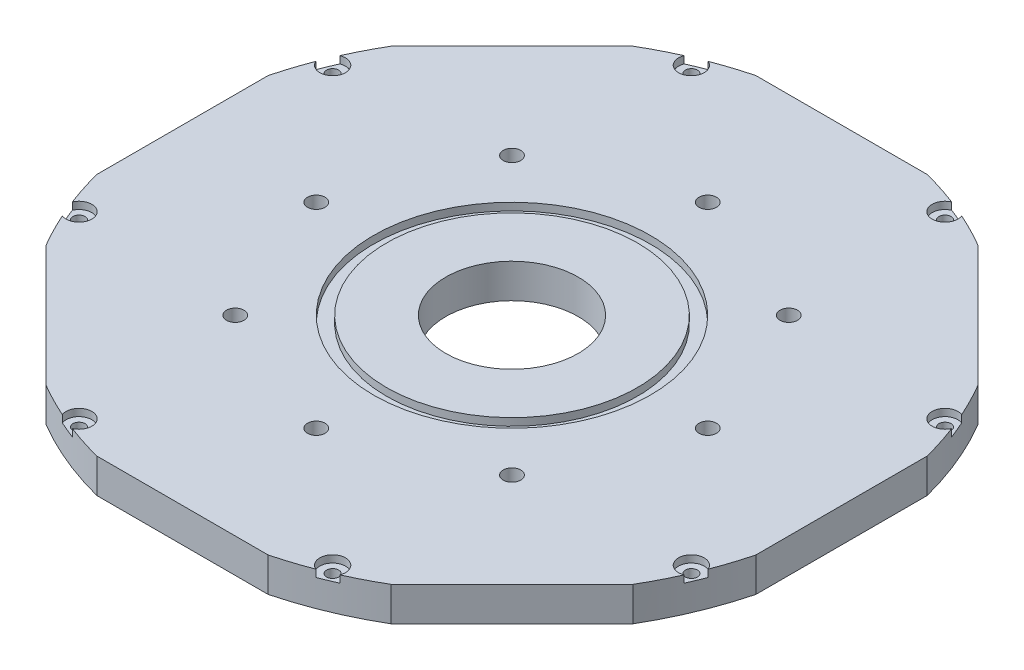
from build123d import *

# Parameters (mm, degrees)
BOSS_EXTRUDE1_DEPTH                                 = 12.7
SKETCH3_R                                           = 24.5745
CUT_EXTRUDE1_DEPTH                                  = 174.423960282
SKETCH5_R                                           = 51.3715
SKETCH5_R_2                                         = 46.5455
CUT_EXTRUDE2_DEPTH                                  = 2.794
CIRPATTERN4_COUNT                                   = 8
CBORE_FOR_8_BINDING_HEAD_MACHINE_SCREW2_D           = 4.4958
CBORE_FOR_8_BINDING_HEAD_MACHINE_SCREW2_CBORE_D     = 9.525
CBORE_FOR_8_BINDING_HEAD_MACHINE_SCREW2_CBORE_DEPTH = 2.667
CIRPATTERN5_COUNT                                   = 8


with BuildPart() as part:
    # Sketch1 → Boss-Extrude1 (new body)
    with BuildSketch(Plane(origin=(0, 0, 0), x_dir=(1, 0, 0), z_dir=(0, 1, 0))):
        with BuildLine():
            ThreePointArc((-31.793446259, 122.3), (-48.357791931, 116.746037126), (-63.997797892, 108.960520786))
            Line((-63.997797892, 108.960520786), (-108.960520786, 63.997797892))
            ThreePointArc((-108.960520786, 63.997797892), (-116.746037126, 48.357791931), (-122.3, 31.793446259))
            Line((-122.3, 31.793446259), (-122.3, -31.793446259))
            ThreePointArc((-122.3, -31.793446259), (-116.746037126, -48.357791931), (-108.960520786, -63.997797892))
            Line((-108.960520786, -63.997797892), (-63.997797892, -108.960520786))
            ThreePointArc((-63.997797892, -108.960520786), (-48.357791931, -116.746037126), (-31.793446259, -122.3))
            Line((-31.793446259, -122.3), (31.793446259, -122.3))
            ThreePointArc((31.793446259, -122.3), (48.357791931, -116.746037126), (63.997797892, -108.960520786))
            Line((63.997797892, -108.960520786), (108.960520786, -63.997797892))
            ThreePointArc((108.960520786, -63.997797892), (116.746037126, -48.357791931), (122.3, -31.793446259))
            Line((122.3, -31.793446259), (122.3, 31.793446259))
            ThreePointArc((122.3, 31.793446259), (116.746037126, 48.357791931), (108.960520786, 63.997797892))
            Line((108.960520786, 63.997797892), (63.997797892, 108.960520786))
            ThreePointArc((63.997797892, 108.960520786), (48.357791931, 116.746037126), (31.793446259, 122.3))
            Line((31.793446259, 122.3), (-31.793446259, 122.3))
        make_face()
    extrude(amount=BOSS_EXTRUDE1_DEPTH)

    # Sketch3 → Cut-Extrude1 (cut, through all)
    with BuildSketch(Plane(origin=(0, 12.7, 0), x_dir=(1, 0, 0), z_dir=(0, 1, 0))):
        Circle(SKETCH3_R)
    extrude(amount=-CUT_EXTRUDE1_DEPTH, mode=Mode.SUBTRACT)

    # Sketch5 → Cut-Extrude2 (cut)
    with BuildSketch(Plane(origin=(0, 12.7, 0), x_dir=(1, 0, 0), z_dir=(0, 1, 0))):
        Circle(SKETCH5_R)
        Circle(SKETCH5_R_2, mode=Mode.SUBTRACT)
    extrude(amount=-CUT_EXTRUDE2_DEPTH, mode=Mode.SUBTRACT)

    # Sketch23 → 5/16-18 Tapped Hole1 (revolve, cut)
    with BuildSketch(Plane(origin=(-72.644, 12.7, 0), x_dir=(0, 0, 1), z_dir=(1, 0, 0))):
        Polygon((0, 0), (0, 8.311148974), (3.2639, 6.35), (3.2639, 0), align=None)
    f_5_16_18_tapped_hole1 = revolve(axis=Axis((-72.644, 19.05, 0), (0, -1, 0)), mode=Mode.SUBTRACT)

    # CirPattern4: 5/16-18 Tapped Hole1 ×8 about axis
    cirpattern4_axis = Axis((0, 0, 0), (0, 1, 0))
    for i in range(1, CIRPATTERN4_COUNT):
        add(f_5_16_18_tapped_hole1.rotate(cirpattern4_axis, i * 360 / CIRPATTERN4_COUNT), mode=Mode.SUBTRACT)

    # CBORE for #8 Binding Head Machine Screw2 (through all)
    with Locations(Plane(origin=(0, 12.7, 0), x_dir=(1, 0, 0), z_dir=(0, 1, 0))):
        with Locations((-47.069870839, 113.636720559)):
            cbore_for_8_binding_head_machine_screw2 = CounterBoreHole(CBORE_FOR_8_BINDING_HEAD_MACHINE_SCREW2_D / 2, CBORE_FOR_8_BINDING_HEAD_MACHINE_SCREW2_CBORE_D / 2, CBORE_FOR_8_BINDING_HEAD_MACHINE_SCREW2_CBORE_DEPTH)

    # CirPattern5: CBORE for #8 Binding Head Machine Screw2 ×8 about axis
    cirpattern5_axis = Axis((0, 0, 0), (0, 1, 0))
    for i in range(1, CIRPATTERN5_COUNT):
        add(cbore_for_8_binding_head_machine_screw2.rotate(cirpattern5_axis, i * 360 / CIRPATTERN5_COUNT), mode=Mode.SUBTRACT)


solid = part.part
